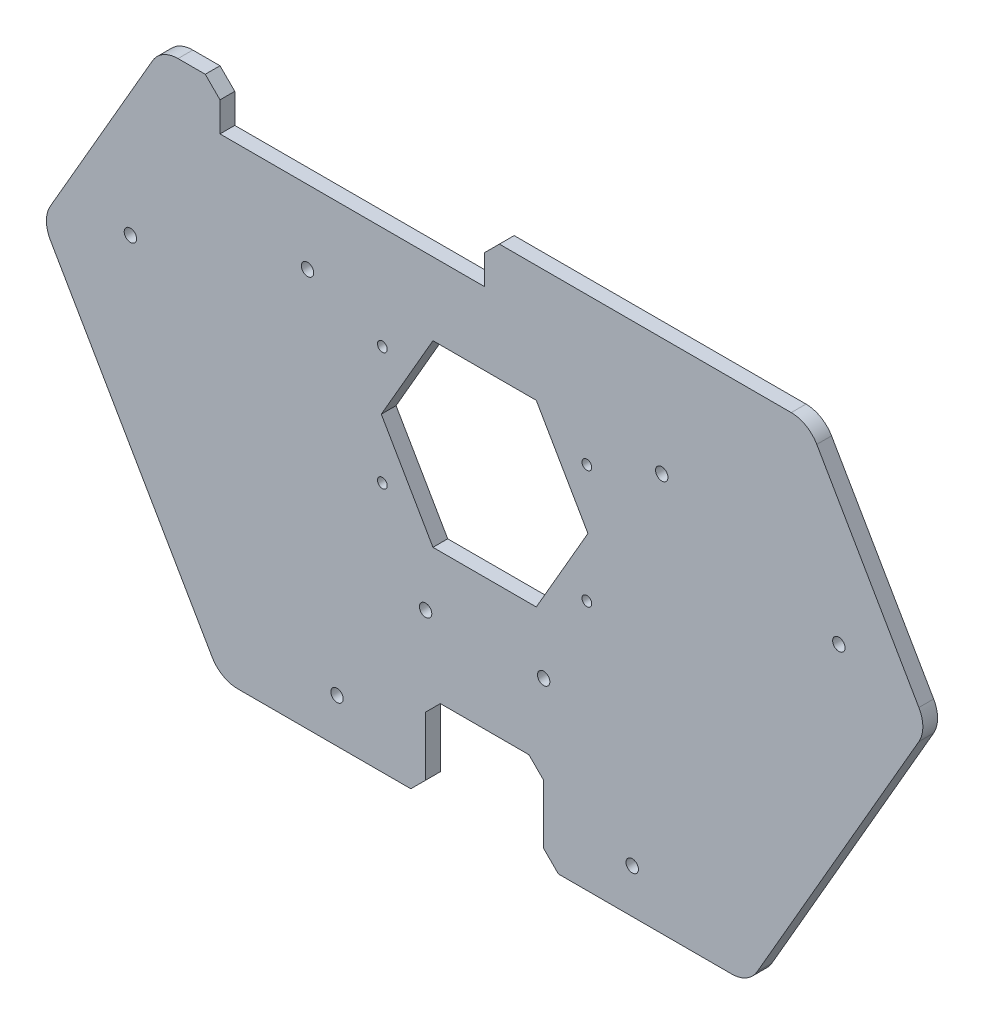
from build123d import *

# Parameters (mm, degrees)
EXTRUDE_1_DEPTH          = 5
CUT_EXTRUDE_2_DEPTH      = 199.494332413
CUT_EXTRUDE_2_DEPTH_BACK = 199.494332413
CUT_EXTRUDE_3_REACH      = 200.494
CHAMFER_1_SIZE           = 5
CUT_EXTRUDE_6_DEPTH      = 199.494332413
CUT_EXTRUDE_6_DEPTH_BACK = 199.494332413
CHAMFER_2_SIZE           = 5
CUT_EXTRUDE_7_REACH      = 185.111
SKETCH_6_R               = 2.1
FILLET_1_R               = 10
M4X0_7_1_D               = 3.3
M4X0_7_1_DEPTH           = 11.5
M4X0_7_1_TIP             = 0.991420021


with BuildPart() as part:
    # 草圖1 → 填料-伸長1 (new body)
    with BuildSketch(Plane.XY):
        Polygon((150, 0), (75, 129.903810568), (-75, 129.903810568), (-150, 0), (-75, -129.903810568), (75, -129.903810568), align=None)
    extrude(amount=EXTRUDE_1_DEPTH)

    # 草圖3 → 除料-伸長2 (cut, two sides: drawn at the far end of the back side and taken through both)
    with BuildSketch(Plane.XY.offset(5).offset(-CUT_EXTRUDE_2_DEPTH_BACK)):
        Polygon((-774.886138932, 69.903810568), (-109.641016151, 69.903810568), (-89.641016151, 69.903810568), (-89.641016151, 54.903810568), (0, 54.903810568), (0, 69.903810568), (109.641016151, 69.903810568), (774.886138932, 69.903810568), (774.886138932, 1400.394056128), (-774.886138932, 1400.394056128), align=None)
    extrude(amount=CUT_EXTRUDE_2_DEPTH + CUT_EXTRUDE_2_DEPTH_BACK, mode=Mode.SUBTRACT)

    # 草圖4 → 除料-伸長3 (cut, up to next)
    with BuildSketch(Plane.XY.offset(5), mode=Mode.PRIVATE) as cut_extrude_3_sk1:
        Polygon((35, 0), (17.5, 30.310889132), (-17.5, 30.310889132), (-35, 0), (-17.5, -30.310889132), (17.5, -30.310889132), align=None)
    cut_extrude_3_tool1 = extrude(cut_extrude_3_sk1.sketch, amount=-CUT_EXTRUDE_3_REACH, mode=Mode.PRIVATE) & part.part
    add(cut_extrude_3_tool1.solids().sort_by_distance((0, 0, 5))[0], mode=Mode.SUBTRACT)

    # 導角1
    chamfer_1_edges = [part.edges().sort_by_distance(p)[0] for p in [
        (0, 69.903810568, 2.5),
        (-89.641016151, 69.903810568, 2.5),
    ]]
    chamfer(chamfer_1_edges, length=CHAMFER_1_SIZE)

    # 草圖5 → 除料-伸長6 (cut, two sides: drawn at the far end of the back side and taken through both)
    with BuildSketch(Plane.XY.offset(5).offset(-CUT_EXTRUDE_6_DEPTH_BACK)):
        Polygon((-692.345987228, -104.903810568), (-89.43375673, -104.903810568), (-20, -104.903810568), (-20, -74.903810568), (20, -74.903810568), (20, -104.903810568), (89.43375673, -104.903810568), (692.345987228, -104.903810568), (692.345987228, -1310.728271565), (-692.345987228, -1310.728271565), align=None)
    extrude(amount=CUT_EXTRUDE_6_DEPTH + CUT_EXTRUDE_6_DEPTH_BACK, mode=Mode.SUBTRACT)

    # 導角2
    chamfer_2_edges = [part.edges().sort_by_distance(p)[0] for p in [
        (20, -104.903810568, 2.5),
        (20, -74.903810568, 2.5),
        (-20, -74.903810568, 2.5),
        (-20, -104.903810568, 2.5),
    ]]
    chamfer(chamfer_2_edges, length=CHAMFER_2_SIZE)

    # 草圖6 → 除料-伸長7 (cut, up to next)
    with BuildSketch(Plane.XY.offset(5), mode=Mode.PRIVATE) as cut_extrude_7_sk1:
        with Locations((-50, -90)):
            Circle(SKETCH_6_R)
    cut_extrude_7_tool1 = extrude(cut_extrude_7_sk1.sketch, amount=-CUT_EXTRUDE_7_REACH, mode=Mode.PRIVATE) & part.part
    # 草圖6 → 除料-伸長7 (cut, up to next)
    with BuildSketch(Plane.XY.offset(5), mode=Mode.PRIVATE) as cut_extrude_7_sk2:
        with Locations((-120, 10)):
            Circle(SKETCH_6_R)
    cut_extrude_7_tool2 = extrude(cut_extrude_7_sk2.sketch, amount=-CUT_EXTRUDE_7_REACH, mode=Mode.PRIVATE) & part.part
    # 草圖6 → 除料-伸長7 (cut, up to next)
    with BuildSketch(Plane.XY.offset(5), mode=Mode.PRIVATE) as cut_extrude_7_sk3:
        with Locations((-60, 30)):
            Circle(SKETCH_6_R)
    cut_extrude_7_tool3 = extrude(cut_extrude_7_sk3.sketch, amount=-CUT_EXTRUDE_7_REACH, mode=Mode.PRIVATE) & part.part
    # 草圖6 → 除料-伸長7 (cut, up to next)
    with BuildSketch(Plane.XY.offset(5), mode=Mode.PRIVATE) as cut_extrude_7_sk4:
        with Locations((-20, -50)):
            Circle(SKETCH_6_R)
    cut_extrude_7_tool4 = extrude(cut_extrude_7_sk4.sketch, amount=-CUT_EXTRUDE_7_REACH, mode=Mode.PRIVATE) & part.part
    cut_extrude_7_1 = cut_extrude_7_tool1.solids().sort_by_distance((-50, -90, 5))[0]
    add(cut_extrude_7_1, mode=Mode.SUBTRACT)
    cut_extrude_7_2 = cut_extrude_7_tool2.solids().sort_by_distance((-120, 10, 5))[0]
    add(cut_extrude_7_2, mode=Mode.SUBTRACT)
    cut_extrude_7_3 = cut_extrude_7_tool3.solids().sort_by_distance((-60, 30, 5))[0]
    add(cut_extrude_7_3, mode=Mode.SUBTRACT)
    cut_extrude_7_4 = cut_extrude_7_tool4.solids().sort_by_distance((-20, -50, 5))[0]
    add(cut_extrude_7_4, mode=Mode.SUBTRACT)
    cut_extrude_7 = cut_extrude_7_1 + cut_extrude_7_2 + cut_extrude_7_3 + cut_extrude_7_4  # 除料-伸長7 as one shape, for the pattern or mirror that repeats it

    # 鏡射1: 除料-伸長7 across plane
    add(cut_extrude_7.mirror(Plane(origin=(0, 0, 0), x_dir=(0, 0, 1), z_dir=(1, 0, 0))), mode=Mode.SUBTRACT)

    # 圓角1
    fillet_1_edges = [part.edges().sort_by_distance(p)[0] for p in [
        (109.641016151, 69.903810568, 2.5),
        (150, 0, 2.5),
        (89.43375673, -104.903810568, 2.5),
        (-89.43375673, -104.903810568, 2.5),
        (-150, 0, 2.5),
        (-109.641016151, 69.903810568, 2.5),
    ]]
    fillet(fillet_1_edges, radius=FILLET_1_R)

    # M4x0.7 螺紋孔1
    with Locations(Plane.XY.offset(5)):
        with Locations((-34.641016151, 20), (34.641016151, 20), (34.641016151, -20), (-34.641016151, -20)):
            Hole(M4X0_7_1_D / 2, depth=M4X0_7_1_DEPTH)
            with Locations((0, 0, -(M4X0_7_1_DEPTH + M4X0_7_1_TIP / 2))):  # 118° drill point
                Cone(0, M4X0_7_1_D / 2, M4X0_7_1_TIP, mode=Mode.SUBTRACT)


solid = part.part
